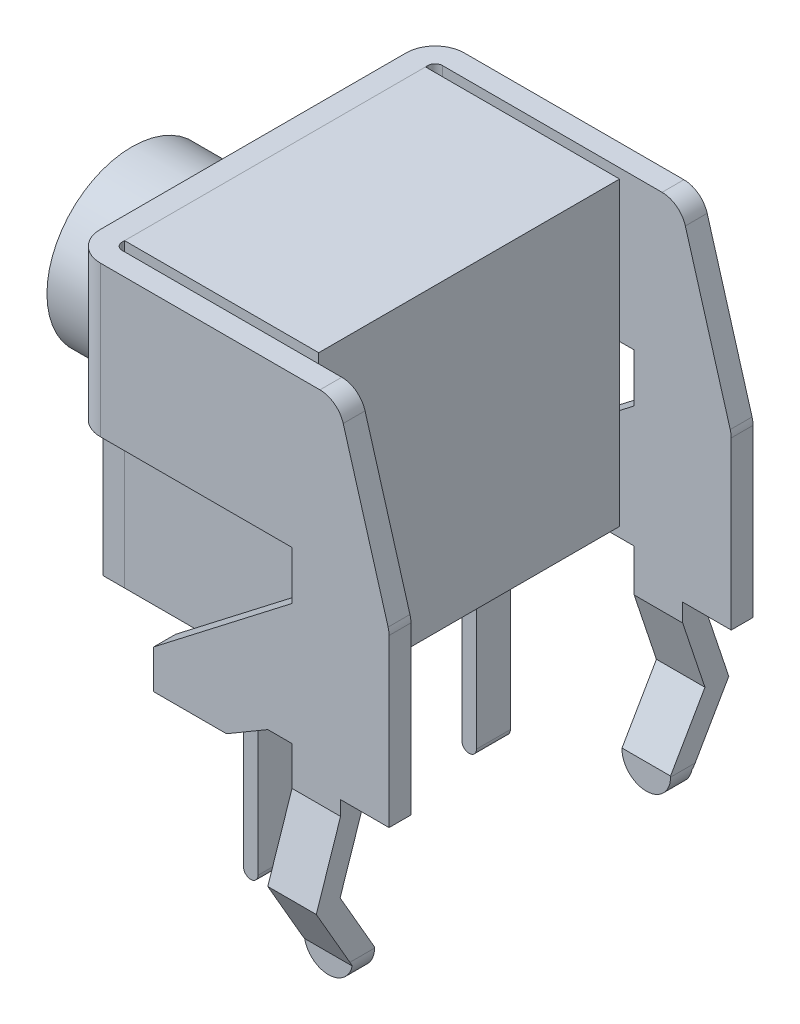
from build123d import *

# Parameters (mm, degrees)
EXTRUDE_1_DEPTH      = 10
EXTRUDE_1_DEPTH_BACK = 10
CUT_EXTRUDE_1_DEPTH  = 15.112140164
FILLET_1_R           = 0.6
FILLET_2_R           = 0.5
SHELL_START          = 0.6
SHELL_1_OUTLINE_W    = 7.1
SHELL_1_OUTLINE_H    = 6.6
SHELL_1_DEPTH        = 5.95
SHELL_START_2        = -8
SHELL_1_2_OUTLINE_W  = 1
SHELL_1_2_OUTLINE_H  = 6.1
SHELL_1_2_DEPTH      = 11.1
SHELL_START_3        = 4.55
SHELL_1_3_DEPTH      = 1
CUT_EXTRUDE_2_DEPTH  = 0.65
SKETCH_5_R           = 0.5
SKETCH_5_R_2         = 1.75
SKETCH_5_W           = 10
SKETCH_5_H           = 2
CUT_EXTRUDE_3_DEPTH  = 0.45
SKETCH_6_W           = 6.2
SKETCH_6_H           = 6.2
EXTRUDE_2_DEPTH      = 4
SKETCH_7_W           = 0.7
SKETCH_7_H           = 5
EXTRUDE_1_2_DEPTH    = 4
SKETCH_8_OUTSIDE_W   = 11.61
SKETCH_8_OUTSIDE_H   = 15.96
CUT_EXTRUDE_4_DEPTH  = 4
EXTRUDE_START        = 0.75
SKETCH_9_R           = 0.5
EXTRUDE_3_DEPTH      = 0.75
EXTRUDE_START_2      = 2.95
SKETCH_9_4_R         = 1.75
EXTRUDE_4_DEPTH      = 2.95


with BuildPart() as part:
    # 草图1 → Extrude 1 (new, two sides: drawn at the far end of the back side and taken through both)
    with BuildSketch(Plane.XY.offset(-EXTRUDE_1_DEPTH_BACK)):
        with BuildLine():
            Line((0, 3.1), (0, -3.1))
            Line((0, -3.1), (0, -4))
            Line((0, -4), (2.4, -4))
            Line((2.4, -4), (2.7, -4))
            Line((2.7, -4), (4.55, -4))
            Line((4.55, -4), (4.55, -7))
            ThreePointArc((4.55, -7), (5.05, -7.5), (5.55, -7))
            Line((5.55, -7), (5.55, -4))
            Line((5.55, -4), (6.55, -4))
            Line((6.55, -4), (6.55, -0.5))
            Line((6.55, -0.5), (5.5, 3.1))
            Line((5.5, 3.1), (0, 3.1))
        make_face()
    extrude(amount=EXTRUDE_1_DEPTH + EXTRUDE_1_DEPTH_BACK)

    # 草图2 → 切除-拉伸1 (cut, symmetric)
    with BuildSketch(Plane(origin=(0, 0, 0), x_dir=(0, 0, -1), z_dir=(1, 0, 0))):
        Polygon((3.75, 49.345660633), (3.75, 3.778219056), (3.75, -4.3), (4.25, -5.8), (3.5, -7.1), (3.5, -7.992367687), (3.5, -53.559809264), (94.634614214, -53.781212981), (94.884614214, 49.124256916), align=None)
    cut_extrude_1 = extrude(amount=CUT_EXTRUDE_1_DEPTH, both=True, mode=Mode.SUBTRACT)

    # 镜向1: 切除-拉伸1 across plane
    add(cut_extrude_1.mirror(Plane.XY), mode=Mode.SUBTRACT)

    # 圆角1
    fillet_1_edges = [part.edges().sort_by_distance(p)[0] for p in [
        (0, -0.45, -3.75),
        (0, -0.45, 3.75),
    ]]
    fillet(fillet_1_edges, radius=FILLET_1_R)

    # 圆角2
    fillet_2_edges = [part.edges().sort_by_distance(p)[0] for p in [
        (6.55, -0.5, 0),
        (5.5, 3.1, 0),
    ]]
    fillet(fillet_2_edges, radius=FILLET_2_R)

    # 抽壳1: read off the stored shape, not the designer's step
    # 抽壳1 outline → 抽壳1 (cut)
    with BuildSketch(Plane.YZ.offset(SHELL_START)):
        with Locations((-0.45, 0)):
            Rectangle(SHELL_1_OUTLINE_W, SHELL_1_OUTLINE_H)
    extrude(amount=SHELL_1_DEPTH, mode=Mode.SUBTRACT)

    # Shell 1 2 outline → Shell 1 2 (cut)
    with BuildSketch(Plane(origin=(0, 0, 0), x_dir=(1, 0, 0), z_dir=(0, 1, 0)).offset(SHELL_START_2)):
        with BuildLine():
            ThreePointArc((0.6, 3.3), (0.493933983, 3.256066017), (0.45, 3.15))
            Line((0.45, 3.15), (0.45, -3.15))
            ThreePointArc((0.45, -3.15), (0.493933983, -3.256066017), (0.6, -3.3))
            Line((0.6, -3.3), (0.6, 3.3))
        make_face()
        with Locations((5.05, 0)):
            Rectangle(SHELL_1_2_OUTLINE_W, SHELL_1_2_OUTLINE_H)
    extrude(amount=SHELL_1_2_DEPTH, mode=Mode.SUBTRACT)

    # Shell 1 3 outline → Shell 1 3 (cut)
    with BuildSketch(Plane.YZ.offset(SHELL_START_3)):
        Polygon((-6.979500139, -3.05), (-5.750368378, -3.759114477), (-4.373024947, -3.3), (-4, -3.3), (-4, -3.05), align=None)
        Polygon((-4.373024947, 3.3), (-5.750368378, 3.759114477), (-6.979500139, 3.05), (-4, 3.05), (-4, 3.3), align=None)
    extrude(amount=SHELL_1_3_DEPTH, mode=Mode.SUBTRACT)

    # 草图4 → 切除-拉伸2 (cut)
    with BuildSketch(Plane.XY.offset(3.75)):
        Polygon((-1.45, 0), (4.55, 0), (4.55, -1), (1.7, -3.2), (1.7, -4), (3.2, -4), (4.05, -3.5), (4.55, -3.5), (4.55, -9.5), (-1.45, -9.5), align=None)
    cut_extrude_2 = extrude(amount=-CUT_EXTRUDE_2_DEPTH, mode=Mode.SUBTRACT)

    # 镜向2: 切除-拉伸2 across plane
    add(cut_extrude_2.mirror(Plane.XY), mode=Mode.SUBTRACT)

    # 草图5 → 切除-拉伸3 (cut)
    with BuildSketch(Plane.ZY):
        with Locations(Location((-2.121320344, 2.121320344, 0), (0, 0, 270))):
            Circle(SKETCH_5_R)
        with Locations(Location((2.121320344, 2.121320344, 0), (0, 0, 270))):
            Circle(SKETCH_5_R)
        with Locations(Location((2.121320344, -2.121320344, 0), (0, 0, 270))):
            Circle(SKETCH_5_R)
        with Locations(Location((-2.121320344, -2.121320344, 0), (0, 0, 270))):
            Circle(SKETCH_5_R)
        with Locations(Location((0, 0, 0), (0, 0, 270))):
            Circle(SKETCH_5_R_2)
        with Locations((0, -4.1)):
            Rectangle(SKETCH_5_W, SKETCH_5_H)
    extrude(amount=-CUT_EXTRUDE_3_DEPTH, mode=Mode.SUBTRACT)


with BuildPart() as body_2:
    # 草图6 → 凸台-拉伸2 (new body)
    with BuildSketch(Plane(origin=(0.45, 0, 0), x_dir=(0, 0, -1), z_dir=(1, 0, 0))):
        Rectangle(SKETCH_6_W, SKETCH_6_H)
    extrude(amount=EXTRUDE_2_DEPTH)


with BuildPart() as body_3:
    # 草图7 → Extrude 1 2 (new body)
    with BuildSketch(Plane(origin=(0, 0, 0), x_dir=(0, 0, -1), z_dir=(1, 0, 0))):
        with Locations((2.25, -5.3)):
            Rectangle(SKETCH_7_W, SKETCH_7_H)
    extrude(amount=EXTRUDE_1_2_DEPTH)

    # 草图8 outside → 切除-拉伸4 (cut)
    with BuildSketch(Plane.XY):
        with Locations((3.275, -2.35)):
            Rectangle(SKETCH_8_OUTSIDE_W, SKETCH_8_OUTSIDE_H)
        with BuildLine():
            Line((2.7, -7.35), (2.7, -1.755439518))
            Line((2.7, -1.755439518), (2.4, -1.755439518))
            Line((2.4, -1.755439518), (2.4, -7.35))
            ThreePointArc((2.4, -7.35), (2.55, -7.5), (2.7, -7.35))
        make_face(mode=Mode.SUBTRACT)
    extrude(amount=-CUT_EXTRUDE_4_DEPTH, mode=Mode.SUBTRACT)


with BuildPart() as body_4:
    # 镜向3: mirrored copy
    add(body_3.part.mirror(Plane.XY))


with BuildPart() as body_3_1:
    add(body_3.part)

    # Combine 1: union body 4, body 2
    add(body_4.part)
    add(body_2.part)

    # 草图9 → 凸台-拉伸3 (add)
    with BuildSketch(Plane.ZY.offset(-0.45).offset(EXTRUDE_START)):
        with Locations(Location((-2.121320344, 2.121320344, 0), (0, 0, 90))):
            Circle(SKETCH_9_R)
        with Locations(Location((2.121320344, 2.121320344, 0), (0, 0, 90))):
            Circle(SKETCH_9_R)
        with Locations(Location((2.121320344, -2.121320344, 0), (0, 0, 90))):
            Circle(SKETCH_9_R)
        with Locations(Location((-2.121320344, -2.121320344, 0), (0, 0, 90))):
            Circle(SKETCH_9_R)
    extrude(amount=-EXTRUDE_3_DEPTH)

    # 草图9<4> → 凸台-拉伸4 (add)
    with BuildSketch(Plane.ZY.offset(-0.45).offset(EXTRUDE_START_2)):
        with Locations(Location((0, 0, 0), (0, 0, 90))):
            Circle(SKETCH_9_4_R)
    extrude(amount=-EXTRUDE_4_DEPTH)


solid = Compound([part.part, body_3_1.part])
